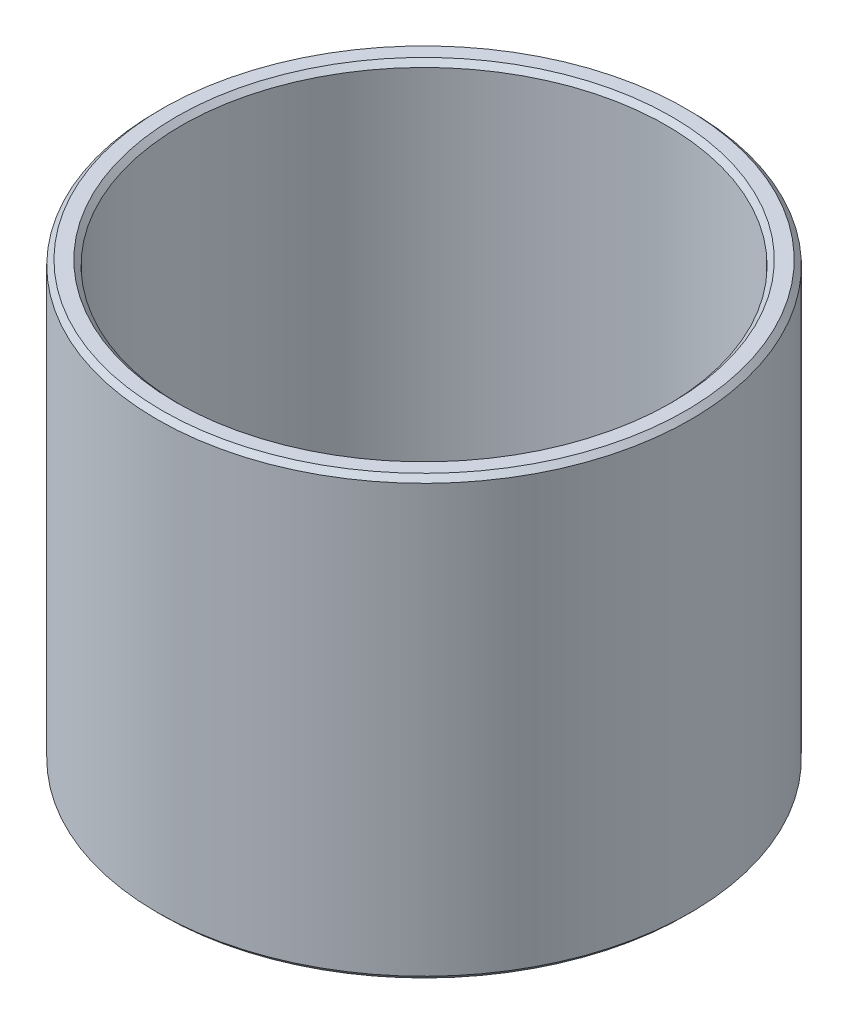
from build123d import *

# Parameters (mm, degrees)
SKETCH1_R           = 47.5
BOSS_EXTRUDE1_DEPTH = 77.8093314
SKETCH2_R           = 43.184274222
CUT_EXTRUDE1_DEPTH  = 103.794902855
CHAMFER1_SIZE       = 0.907020565


with BuildPart() as part:
    # Sketch1 → Boss-Extrude1 (new body)
    with BuildSketch(Plane(origin=(0, 0, 0), x_dir=(1, 0, 0), z_dir=(0, 1, 0))):
        Circle(SKETCH1_R)
    extrude(amount=BOSS_EXTRUDE1_DEPTH)

    # Sketch2 → Cut-Extrude1 (cut, through all)
    with BuildSketch(Plane(origin=(0, 0, 0), x_dir=(1, 0, 0), z_dir=(0, 1, 0))):
        Circle(SKETCH2_R)
    extrude(amount=CUT_EXTRUDE1_DEPTH, mode=Mode.SUBTRACT)

    # Chamfer1
    chamfer1_edges = [part.edges().sort_by_distance(p)[0] for p in [
        (-43.184274222, 77.8093314, 0),
        (-43.184274222, 0, 0),
        (-47.5, 0, 0),
        (-47.5, 77.8093314, 0),
    ]]
    chamfer(chamfer1_edges, length=CHAMFER1_SIZE)


solid = part.part
